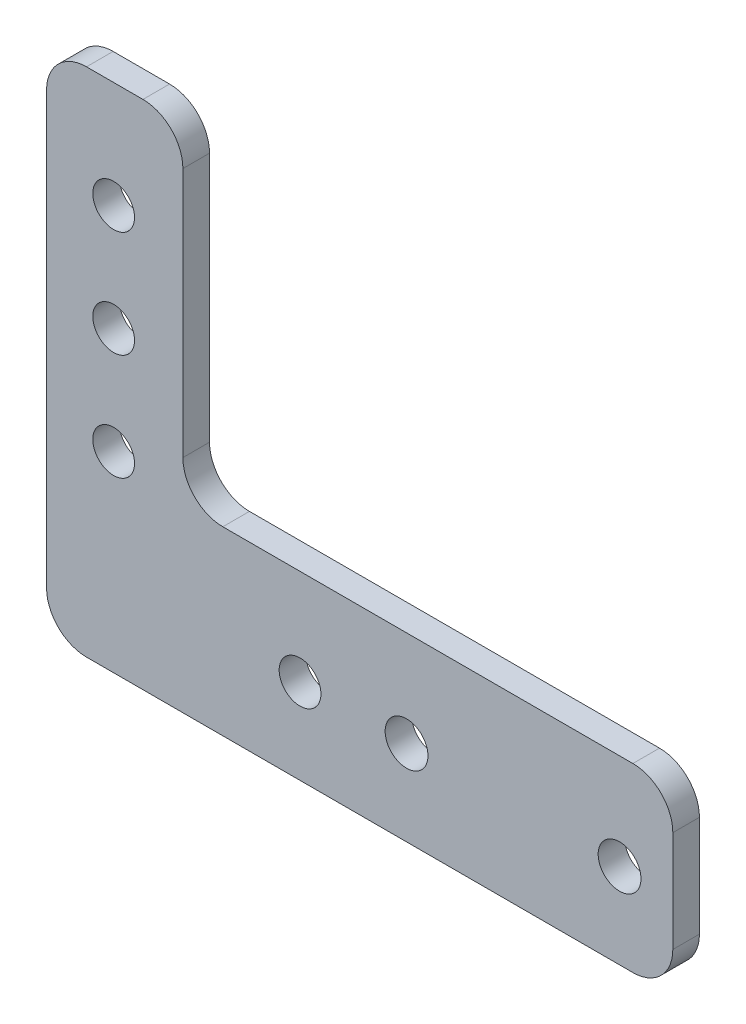
from build123d import *

# Parameters (mm, degrees)
SKETCH1_R           = 2.4892
SKETCH1_R_2         = 2.5527
BOSS_EXTRUDE1_DEPTH = 3.175
FILLET1_R           = 4.7625


with BuildPart() as part:
    # Sketch1 → Boss-Extrude1 (new body)
    with BuildSketch(Plane.XY):
        Polygon((-33.401, 31.75), (-33.401, -29.21), (41.275, -29.21), (41.275, -7.62), (-17.145, -7.62), (-17.145, 31.75), align=None)
        with Locations((-3.175, -19.05)):
            Circle(SKETCH1_R, mode=Mode.SUBTRACT)
        with Locations((-25.4, -6.35)):
            Circle(SKETCH1_R, mode=Mode.SUBTRACT)
        with Locations((9.525, -19.05)):
            Circle(SKETCH1_R_2, mode=Mode.SUBTRACT)
        with Locations((34.925, -19.05)):
            Circle(SKETCH1_R_2, mode=Mode.SUBTRACT)
        with Locations((-25.4, 6.35)):
            Circle(SKETCH1_R, mode=Mode.SUBTRACT)
        with Locations((-25.4, 19.05)):
            Circle(SKETCH1_R, mode=Mode.SUBTRACT)
    extrude(amount=BOSS_EXTRUDE1_DEPTH)

    # Fillet1
    fillet1_edges = [part.edges().sort_by_distance(p)[0] for p in [
        (-33.401, 31.75, 1.5875),
        (-17.145, 31.75, 1.5875),
        (-17.145, -7.62, 1.5875),
        (41.275, -7.62, 1.5875),
        (41.275, -29.21, 1.5875),
        (-33.401, -29.21, 1.5875),
    ]]
    fillet(fillet1_edges, radius=FILLET1_R)


solid = part.part
